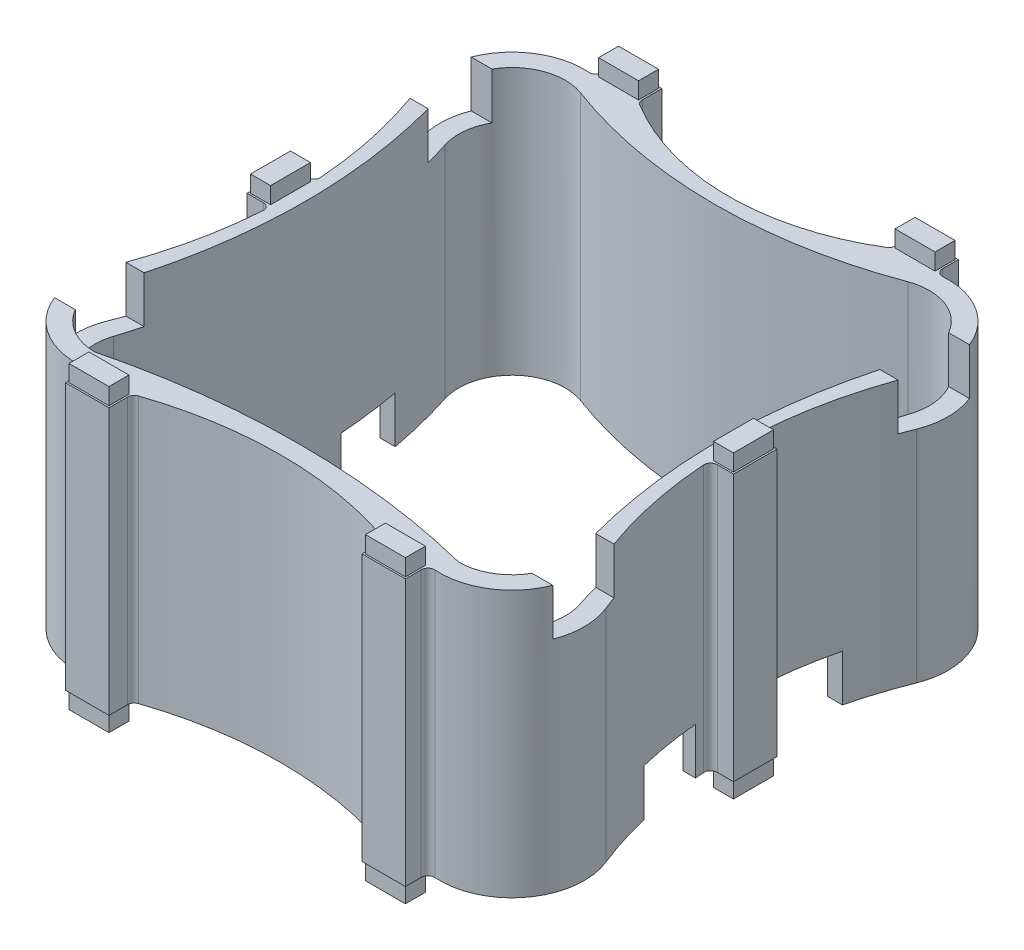
from build123d import *

# Parameters (mm, degrees)
EXTRUDE_1_DEPTH        = 40
SKETCH_5_W             = 3
SKETCH_5_H             = 6
SKETCH_5_W_2           = 6
SKETCH_5_H_2           = 3
EXTRUDE_3_DEPTH        = 2.5
SKETCH_6_W             = 6
SKETCH_6_H             = 3
SKETCH_6_W_2           = 3
SKETCH_6_H_2           = 6
EXTRUDE_4_DEPTH        = 2.5
FILLET_1_R             = 1
CUT_EXTRUDE_8754_DEPTH = 7
CUT_EXTRUDE_START      = -7
CUT_EXTRUDE_9199_DEPTH = 7


with BuildPart() as part:
    # 草图2 → 凸台-拉伸1 (new body)
    with BuildSketch(Plane(origin=(0, 0, 0), x_dir=(1, 0, 0), z_dir=(0, 1, 0))):
        with BuildLine():
            Line((-33, 3.25), (-36.5, 3.25))
            Line((-36.5, 3.25), (-36.5, -3.25))
            Line((-36.5, -3.25), (-33, -3.25))
            ThreePointArc((-33, -3.25), (-34.3699608, -13.457697281), (-37.384420147, -23.305890579))
            ThreePointArc((-37.384420147, -23.305890579), (-35.741677738, -34.13030337), (-25.5, -38))
            Line((-25.5, -38), (-25.5, -41.5))
            Line((-25.5, -41.5), (-19, -41.5))
            Line((-19, -41.5), (-19, -38))
            ThreePointArc((-19, -38), (0, -34.737686486), (19, -38))
            Line((19, -38), (19, -41.5))
            Line((19, -41.5), (25.5, -41.5))
            Line((25.5, -41.5), (25.5, -38))
            ThreePointArc((25.5, -38), (35.741677738, -34.13030337), (37.384420147, -23.305890579))
            ThreePointArc((37.384420147, -23.305890579), (34.3699608, -13.457697281), (33, -3.25))
            Line((33, -3.25), (36.5, -3.25))
            Line((36.5, -3.25), (36.5, 3.25))
            Line((36.5, 3.25), (33, 3.25))
            ThreePointArc((33, 3.25), (34.3699608, 13.457697281), (37.384420147, 23.305890579))
            ThreePointArc((37.384420147, 23.305890579), (35.741677738, 34.13030337), (25.5, 38))
            Line((25.5, 38), (25.5, 41.5))
            Line((25.5, 41.5), (19, 41.5))
            Line((19, 41.5), (19, 38))
            ThreePointArc((19, 38), (0, 32.48661644), (-19, 38))
            Line((-19, 38), (-19, 41.5))
            Line((-19, 41.5), (-25.5, 41.5))
            Line((-25.5, 41.5), (-25.5, 38))
            ThreePointArc((-25.5, 38), (-35.741677738, 34.13030337), (-37.384420147, 23.305890579))
            ThreePointArc((-37.384420147, 23.305890579), (-34.3699608, 13.457697281), (-33, 3.25))
        make_face()
        with BuildLine():
            ThreePointArc((-24.584159113, 34.841334273), (-32.862117731, 33.087897358), (-34.944211337, 24.886432483))
            ThreePointArc((-34.944211337, 24.886432483), (-31.079757149, 0), (-34.944211337, -24.886432483))
            ThreePointArc((-34.944211337, -24.886432483), (-33.784066651, -32.031796166), (-27.335670062, -35.32122458))
            ThreePointArc((-27.335670062, -35.32122458), (0, -31.93514908), (27.335670062, -35.32122458))
            ThreePointArc((27.335670062, -35.32122458), (33.784066651, -32.031796166), (34.944211337, -24.886432483))
            ThreePointArc((34.944211337, -24.886432483), (31.079757149, 0), (34.944211337, 24.886432483))
            ThreePointArc((34.944211337, 24.886432483), (32.862117731, 33.087897358), (24.584159113, 34.841334273))
            ThreePointArc((24.584159113, 34.841334273), (0, 30.397281148), (-24.584159113, 34.841334273))
        make_face(mode=Mode.SUBTRACT)
    extrude(amount=-EXTRUDE_1_DEPTH)

    # 草图5 → 凸台-拉伸3 (add)
    with BuildSketch(Plane(origin=(0, 0, 0), x_dir=(1, 0, 0), z_dir=(0, 1, 0))):
        with Locations((-34.75, 0)):
            Rectangle(SKETCH_5_W, SKETCH_5_H)
        with Locations((-22.25, -39.75)):
            Rectangle(SKETCH_5_W_2, SKETCH_5_H_2)
        with Locations((-22.25, 39.75)):
            Rectangle(SKETCH_5_W_2, SKETCH_5_H_2)
        with Locations((22.25, 39.75)):
            Rectangle(SKETCH_5_W_2, SKETCH_5_H_2)
        with Locations((22.25, -39.75)):
            Rectangle(SKETCH_5_W_2, SKETCH_5_H_2)
        with Locations((34.75, 0)):
            Rectangle(SKETCH_5_W, SKETCH_5_H)
    extrude(amount=EXTRUDE_3_DEPTH)

    # 草图6 → 凸台-拉伸4 (add)
    with BuildSketch(Plane.XZ.offset(40)):
        with Locations((-22.25, 39.75)):
            Rectangle(SKETCH_6_W, SKETCH_6_H)
        with Locations((-34.75, 0)):
            Rectangle(SKETCH_6_W_2, SKETCH_6_H_2)
        with Locations((-22.25, -39.75)):
            Rectangle(SKETCH_6_W, SKETCH_6_H)
        with Locations((22.25, 39.75)):
            Rectangle(SKETCH_6_W, SKETCH_6_H)
        with Locations((22.25, -39.75)):
            Rectangle(SKETCH_6_W, SKETCH_6_H)
        with Locations((34.75, 0)):
            Rectangle(SKETCH_6_W_2, SKETCH_6_H_2)
    extrude(amount=EXTRUDE_4_DEPTH)

    # 圆角1
    fillet_1_edges = [part.edges().sort_by_distance(p)[0] for p in [
        (33, -20, -3.25),
        (25.5, -20, -38),
        (-19, -20, -38),
        (19, -20, -38),
        (-25.5, -20, -38),
        (-33, -20, -3.25),
        (19, -20, 38),
        (33, -20, 3.25),
        (25.5, -20, 38),
        (-19, -20, 38),
        (-25.5, -20, 38),
        (-33, -20, 3.25),
    ]]
    fillet(fillet_1_edges, radius=FILLET_1_R)

    # 草图7 → Cut-Extrude 8754 (cut)
    with BuildSketch(Plane(origin=(0, 0, 0), x_dir=(1, 0, 0), z_dir=(0, 1, 0))):
        with BuildLine():
            Line((-36.633725749, -21.323718343), (-33.898557891, -21.323718343))
            ThreePointArc((-33.898557891, -21.323718343), (-34.401232724, -23.110989975), (-34.944211337, -24.886432483))
            ThreePointArc((-34.944211337, -24.886432483), (-35.274550553, -28.150449442), (-34.273344825, -31.274632183))
            Line((-34.273344825, -31.274632183), (-37.421883074, -31.274632183))
            ThreePointArc((-37.421883074, -31.274632183), (-38.165581654, -27.580951917), (-37.605977079, -23.854934713))
            ThreePointArc((-37.605977079, -23.854934713), (-37.106234952, -22.594556671), (-36.633725749, -21.323718343))
        make_face()
        with BuildLine():
            Line((36.633725749, -21.323718343), (33.898557891, -21.323718343))
            ThreePointArc((33.898557891, -21.323718343), (34.401232724, -23.110989975), (34.944211337, -24.886432483))
            ThreePointArc((34.944211337, -24.886432483), (35.274550553, -28.150449442), (34.273344825, -31.274632183))
            Line((34.273344825, -31.274632183), (37.421883074, -31.274632183))
            ThreePointArc((37.421883074, -31.274632183), (38.165581654, -27.580951917), (37.605977079, -23.854934713))
            ThreePointArc((37.605977079, -23.854934713), (37.106234952, -22.594556671), (36.633725749, -21.323718343))
        make_face()
        with BuildLine():
            Line((-36.633725749, 21.323718343), (-33.898557891, 21.323718343))
            ThreePointArc((-33.898557891, 21.323718343), (-34.401232724, 23.110989975), (-34.944211337, 24.886432483))
            ThreePointArc((-34.944211337, 24.886432483), (-35.274550553, 28.150449442), (-34.273344825, 31.274632183))
            Line((-34.273344825, 31.274632183), (-37.421883074, 31.274632183))
            ThreePointArc((-37.421883074, 31.274632183), (-38.165581654, 27.580951917), (-37.605977079, 23.854934713))
            ThreePointArc((-37.605977079, 23.854934713), (-37.106234952, 22.594556671), (-36.633725749, 21.323718343))
        make_face()
        with BuildLine():
            Line((37.421883074, 31.274632183), (34.273344825, 31.274632183))
            ThreePointArc((34.273344825, 31.274632183), (35.274550553, 28.150449442), (34.944211337, 24.886432483))
            ThreePointArc((34.944211337, 24.886432483), (34.401232724, 23.110989975), (33.898557891, 21.323718343))
            Line((33.898557891, 21.323718343), (36.633725749, 21.323718343))
            ThreePointArc((36.633725749, 21.323718343), (37.106234952, 22.594556671), (37.605977079, 23.854934713))
            ThreePointArc((37.605977079, 23.854934713), (38.165581654, 27.580951917), (37.421883074, 31.274632183))
        make_face()
    extrude(amount=-CUT_EXTRUDE_8754_DEPTH, mode=Mode.SUBTRACT)

    # 草图8 → Cut-Extrude 9199 (cut)
    with BuildSketch(Plane.XZ.offset(40).offset(CUT_EXTRUDE_START)):
        with BuildLine():
            Line((-33.167247328, -5.619996041), (-31.272419616, -5.619996041))
            ThreePointArc((-31.272419616, -5.619996041), (-31.726152882, -10.279804399), (-32.444885624, -14.906154046))
            Line((-32.444885624, -14.906154046), (-34.704557814, -14.906154046))
            ThreePointArc((-34.704557814, -14.906154046), (-33.762273508, -10.291819093), (-33.167247328, -5.619996041))
        make_face()
        with BuildLine():
            Line((-34.704557814, 14.906154046), (-32.444885624, 14.906154046))
            ThreePointArc((-32.444885624, 14.906154046), (-31.726152882, 10.279804399), (-31.272419616, 5.619996041))
            Line((-31.272419616, 5.619996041), (-33.167247328, 5.619996041))
            ThreePointArc((-33.167247328, 5.619996041), (-33.762273508, 10.291819093), (-34.704557814, 14.906154046))
        make_face()
        with BuildLine():
            Line((33.167247328, -5.619996041), (31.272419616, -5.619996041))
            ThreePointArc((31.272419616, -5.619996041), (31.726152882, -10.279804399), (32.444885624, -14.906154046))
            Line((32.444885624, -14.906154046), (34.704557814, -14.906154046))
            ThreePointArc((34.704557814, -14.906154046), (33.762273508, -10.291819093), (33.167247328, -5.619996041))
        make_face()
        with BuildLine():
            Line((33.167247328, 5.619996041), (31.272419616, 5.619996041))
            ThreePointArc((31.272419616, 5.619996041), (31.726152882, 10.279804399), (32.444885624, 14.906154046))
            Line((32.444885624, 14.906154046), (34.704557814, 14.906154046))
            ThreePointArc((34.704557814, 14.906154046), (33.762273508, 10.291819093), (33.167247328, 5.619996041))
        make_face()
    extrude(amount=CUT_EXTRUDE_9199_DEPTH, mode=Mode.SUBTRACT)


solid = part.part
